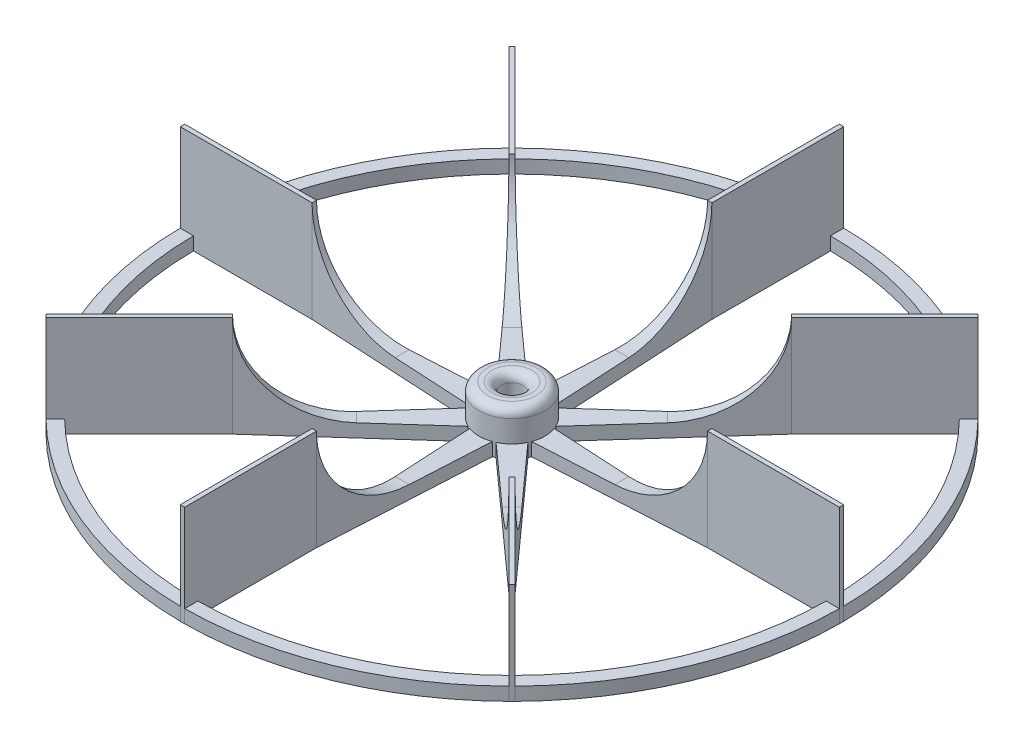
from build123d import *

# Parameters (mm, degrees)
BOSS_EXTRUDE1_DEPTH      = 3.81
SKETCH2_W                = 1.27
SKETCH2_H                = 38.1
BOSS_EXTRUDE2_DEPTH      = 25.4
FILLET1_R                = 25.4
SKETCH4_R                = 9.525
SKETCH4_R_2              = 3.175
BOSS_EXTRUDE3_DEPTH      = 12.7
CIRPATTERN5_COUNT        = 8
FILLET1_OF_CIRPATTERN5_R = 25.4
SKETCH5_R                = 95.25
SKETCH5_R_2              = 91.44
BOSS_EXTRUDE4_DEPTH      = 3.81
FILLET2_R                = 2.54


with BuildPart() as part:
    # Sketch1 → Boss-Extrude1 (new body)
    with BuildSketch(Plane(origin=(0, 0, 0), x_dir=(1, 0, 0), z_dir=(0, 1, 0))):
        with BuildLine():
            Line((-0.635, 57.15), (-3.257741865, 8.950572213))
            ThreePointArc((-3.257741865, 8.950572213), (0, 9.525), (3.257741865, 8.950572213))
            Line((3.257741865, 8.950572213), (0.635, 57.15))
            Line((0.635, 57.15), (0.635, 95.25))
            Line((0.635, 95.25), (-0.635, 95.25))
            Line((-0.635, 95.25), (-0.635, 57.15))
        make_face()
    boss_extrude1 = extrude(amount=BOSS_EXTRUDE1_DEPTH)

    # Sketch2 → Boss-Extrude2 (add)
    with BuildSketch(Plane(origin=(0, 3.81, 0), x_dir=(1, 0, 0), z_dir=(0, 1, 0))):
        with Locations((0, 76.2)):
            Rectangle(SKETCH2_W, SKETCH2_H)
    boss_extrude2 = extrude(amount=BOSS_EXTRUDE2_DEPTH)

    # Fillet1
    fillet1_edges = [part.edges().sort_by_distance(p)[0] for p in [
        (0, 3.81, -57.15),
    ]]
    fillet(fillet1_edges, radius=FILLET1_R - 0.0001)  # a hair under: the kernel refuses the full size

    # Sketch4 → Boss-Extrude3 (add)
    with BuildSketch(Plane(origin=(0, 0, 0), x_dir=(1, 0, 0), z_dir=(0, 1, 0))):
        with Locations(Location((0, 0, 0), (0, 0, 70))):
            Circle(SKETCH4_R)
        with Locations(Location((0, 0, 0), (0, 0, 270))):
            Circle(SKETCH4_R_2, mode=Mode.SUBTRACT)
    extrude(amount=BOSS_EXTRUDE3_DEPTH)

    # CirPattern5: Boss-Extrude1, Boss-Extrude2 ×8 about axis
    cirpattern5_axis = Axis((0, 0, 0), (0, 1, 0))
    add([boss_extrude1.rotate(cirpattern5_axis, i * 360 / CIRPATTERN5_COUNT) for i in range(1, CIRPATTERN5_COUNT)])
    add([boss_extrude2.rotate(cirpattern5_axis, i * 360 / CIRPATTERN5_COUNT) for i in range(1, CIRPATTERN5_COUNT)])

    # Fillet1 of CirPattern5
    fillet1_of_cirpattern5_edges = [part.edges().sort_by_distance(p)[0] for p in [
        (-40.411152545, 3.81, -40.411152545),
        (-57.15, 3.81, 0),
        (-40.411152545, 3.81, 40.411152545),
        (0, 3.81, 57.15),
        (40.411152545, 3.81, 40.411152545),
        (57.15, 3.81, 0),
        (40.411152545, 3.81, -40.411152545),
    ]]
    fillet(fillet1_of_cirpattern5_edges, radius=FILLET1_OF_CIRPATTERN5_R - 0.0001)  # a hair under: the kernel refuses the full size

    # Sketch5 → Boss-Extrude4 (add)
    with BuildSketch(Plane(origin=(0, 0, 0), x_dir=(1, 0, 0), z_dir=(0, 1, 0))):
        Circle(SKETCH5_R)
        Circle(SKETCH5_R_2, mode=Mode.SUBTRACT)
    extrude(amount=BOSS_EXTRUDE4_DEPTH)

    # Fillet2
    fillet2_edges = [part.edges().sort_by_distance(p)[0] for p in [
        (-3.257741865, 12.7, 8.950572213),
        (0, 12.7, -3.175),
    ]]
    fillet(fillet2_edges, radius=FILLET2_R)


solid = part.part
